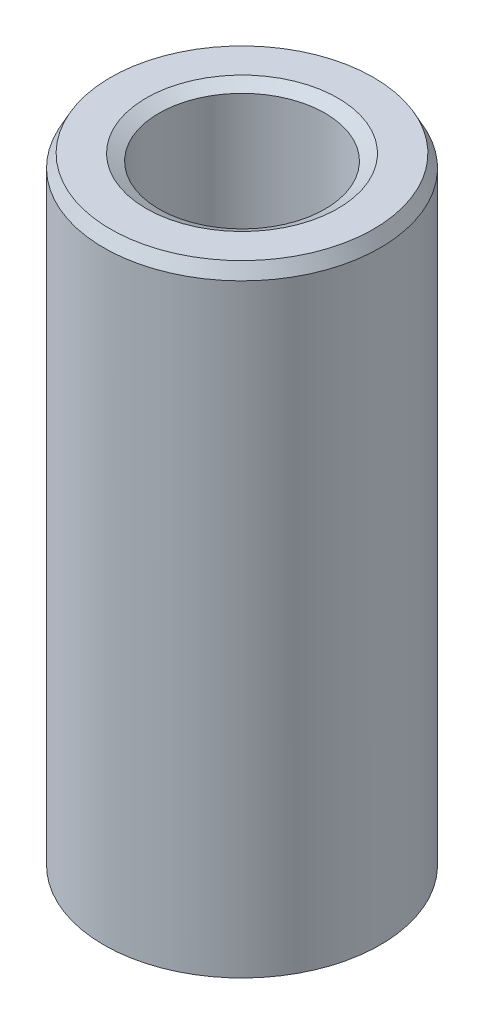
from build123d import *
from OCP.BRepFilletAPI import BRepFilletAPI_MakeChamfer

# Parameters (mm, degrees)
SKETCH1_R           = 20
BOSS_EXTRUDE1_DEPTH = 90.162754073
SKETCH2_R           = 12.016694237
CUT_EXTRUDE1_DEPTH  = 95.495090994
CHAMFER1_SIZE       = 1.844853722
CHAMFER1_SIZE2      = 0.98055578


with BuildPart() as part:
    # Sketch1 → Boss-Extrude1 (new body)
    with BuildSketch(Plane(origin=(0, 0, 0), x_dir=(1, 0, 0), z_dir=(0, 1, 0))):
        Circle(SKETCH1_R)
    extrude(amount=BOSS_EXTRUDE1_DEPTH)

    # Sketch2 → Cut-Extrude1 (cut, through all)
    with BuildSketch(Plane(origin=(0, 0, 0), x_dir=(1, 0, 0), z_dir=(0, 1, 0))):
        Circle(SKETCH2_R)
    extrude(amount=CUT_EXTRUDE1_DEPTH, mode=Mode.SUBTRACT)

    # Chamfer1: one chamfer whose edges measure the first distance from different faces: ONE call of the kernel's chamfer builder (chamfer() names one face for all edges)
    chamfer1_edges_1 = [part.edges().sort_by_distance(p)[0] for p in [
        (-12.016694237, 90.162754073, 0),
    ]]
    chamfer1_side_1 = [part.faces().sort_by_distance(p)[0] for p in [
        (-19.434314575, 90.162754073, 0),
    ]]
    chamfer1_edges_2 = [part.edges().sort_by_distance(p)[0] for p in [
        (-12.016694237, 0, 0),
    ]]
    chamfer1_side_2 = [part.faces().sort_by_distance(p)[0] for p in [
        (-12.016694237, 45.081377037, 0),
    ]]
    chamfer1_edges_3 = [part.edges().sort_by_distance(p)[0] for p in [
        (-20, 0, 0),
    ]]
    chamfer1_side_3 = [part.faces().sort_by_distance(p)[0] for p in [
        (-19.434314575, 0, 0),
    ]]
    chamfer1_edges_4 = [part.edges().sort_by_distance(p)[0] for p in [
        (-20, 90.162754073, 0),
    ]]
    chamfer1_side_4 = [part.faces().sort_by_distance(p)[0] for p in [
        (-20, 45.081377037, 0),
    ]]
    chamfer1 = BRepFilletAPI_MakeChamfer(part.part.solid().wrapped)
    for e in chamfer1_edges_1:
        chamfer1.Add(CHAMFER1_SIZE, CHAMFER1_SIZE2, e.wrapped, chamfer1_side_1[0].wrapped)  # the first distance lies on this face
    for e in chamfer1_edges_2:
        chamfer1.Add(CHAMFER1_SIZE, CHAMFER1_SIZE2, e.wrapped, chamfer1_side_2[0].wrapped)  # the first distance lies on this face
    for e in chamfer1_edges_3:
        chamfer1.Add(CHAMFER1_SIZE, CHAMFER1_SIZE2, e.wrapped, chamfer1_side_3[0].wrapped)  # the first distance lies on this face
    for e in chamfer1_edges_4:
        chamfer1.Add(CHAMFER1_SIZE, CHAMFER1_SIZE2, e.wrapped, chamfer1_side_4[0].wrapped)  # the first distance lies on this face
    add(Compound.cast(chamfer1.Shape()), mode=Mode.REPLACE)


solid = part.part
